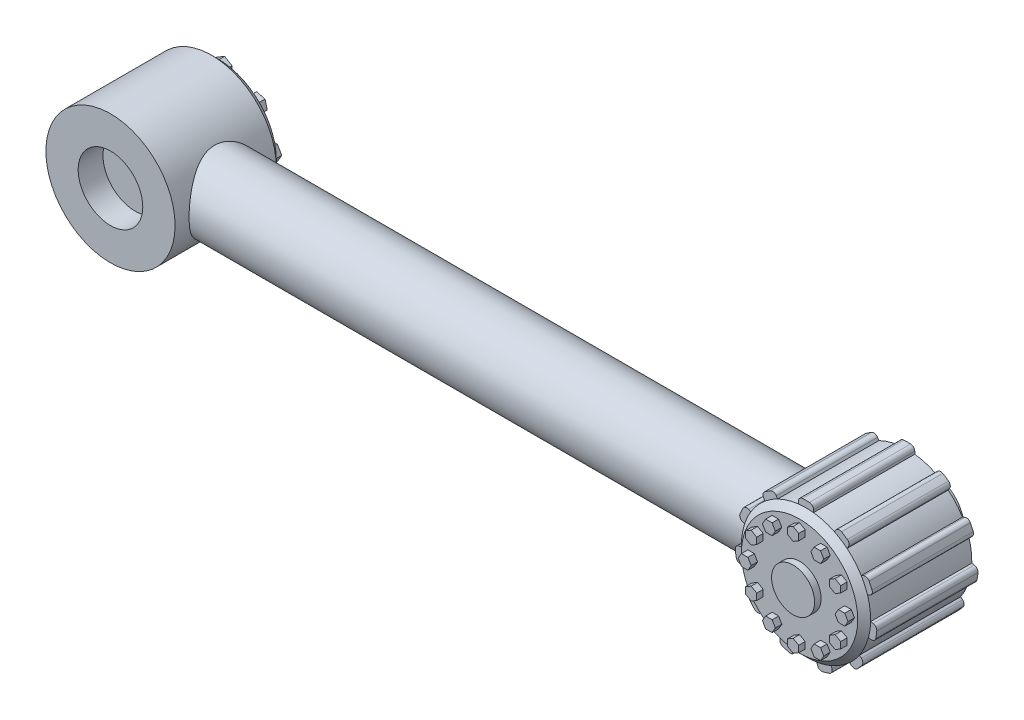
from build123d import *
from build123d.topology import SkipClean

# Parameters (mm, degrees)
BOSS_EXTRUDE2_DEPTH                  = 47
BOSS_EXTRUDE3_START                  = 3
SKETCH2_R                            = 30
BOSS_EXTRUDE3_DEPTH                  = 3
CHAMFER1_SIZE                        = 3
BOSS_EXTRUDE4_DEPTH                  = 3
BOSS_EXTRUDE4_DEPTH_BACK             = 47
SKETCH3_R                            = 30
CHAMFER2_SIZE                        = 3
SKETCH4_R                            = 15
CUT_EXTRUDE1_DEPTH                   = 11.5
SKETCH5_R                            = 15
BOSS_EXTRUDE5_DEPTH                  = 11.5
SKETCH6_R                            = 17.5
BOSS_EXTRUDE6_DEPTH                  = 163.5
BOSS_EXTRUDE6_DIRECTION_2_REACH      = 206.223
BOSS_EXTRUDE6_DIRECTION_2_END_RADIUS = 30
SKETCH7_R                            = 10
BOSS_EXTRUDE7_DEPTH                  = 3
SKETCH8_R                            = 10
BOSS_EXTRUDE8_DEPTH                  = 3


with BuildPart() as part:
    # Sketch1 → Boss-Extrude2 (new body)
    with BuildSketch(Plane.XY):
        with BuildLine():
            Line((156.5, 29.795133831), (156.5, 30.963688411))
            ThreePointArc((156.5, 30.963688411), (157.051975762, 32.343262913), (158.403225806, 32.961345728))
            ThreePointArc((158.403225806, 32.961345728), (160, 33), (161.596774194, 32.961345728))
            ThreePointArc((161.596774194, 32.961345728), (162.948024238, 32.343262913), (163.5, 30.963688411))
            Line((163.5, 30.963688411), (163.5, 29.795133831))
            ThreePointArc((163.5, 29.795133831), (168.451976705, 28.784789208), (173.164078146, 26.957504458))
            Line((173.164078146, 26.957504458), (173.795846449, 27.940555126))
            ThreePointArc((173.795846449, 27.940555126), (175.006052295, 28.802706422), (176.476956967, 28.592129846))
            ThreePointArc((176.476956967, 28.592129846), (177.841146976, 27.761366583), (179.16354083, 26.865567235))
            ThreePointArc((179.16354083, 26.865567235), (179.966123905, 25.615061955), (179.684621179, 24.156069404))
            Line((179.684621179, 24.156069404), (179.052852875, 23.173018735))
            ThreePointArc((179.052852875, 23.173018735), (182.672487231, 19.645822018), (185.648654493, 15.561057891))
            Line((185.648654493, 15.561057891), (186.711609127, 16.046493007))
            ThreePointArc((186.711609127, 16.046493007), (188.195813252, 16.117494153), (189.319370711, 15.14511476))
            ThreePointArc((189.319370711, 15.14511476), (190.017855847, 13.708695429), (190.646018656, 12.240160968))
            ThreePointArc((190.646018656, 12.240160968), (190.645120307, 10.754259814), (189.619514218, 9.67906904))
            Line((189.619514218, 9.67906904), (188.556559584, 9.193633924))
            ThreePointArc((188.556559584, 9.193633924), (189.694643256, 4.269445148), (189.989964263, -0.775914606))
            Line((189.989964263, -0.775914606), (191.146624643, -0.942217262))
            ThreePointArc((191.146624643, -0.942217262), (192.433602724, -1.684908629), (192.853091416, -3.110367252))
            ThreePointArc((192.853091416, -3.110367252), (192.664107582, -4.696389663), (192.398602093, -6.271409921))
            ThreePointArc((192.398602093, -6.271409921), (191.594507539, -7.520943833), (190.150420775, -7.870967355))
            Line((190.150420775, -7.870967355), (188.993760396, -7.704664699))
            ThreePointArc((188.993760396, -7.704664699), (187.288959861, -12.46245039), (184.809672279, -16.866539698))
            Line((184.809672279, -16.866539698), (185.692806906, -17.631780208))
            ThreePointArc((185.692806906, -17.631780208), (186.373952496, -18.952364826), (185.956187724, -20.378329638))
            ThreePointArc((185.956187724, -20.378329638), (184.939735954, -21.61040422), (183.864858283, -22.791852472))
            ThreePointArc((183.864858283, -22.791852472), (182.512861863, -23.408300952), (181.108781768, -22.922027229))
            Line((181.108781768, -22.922027229), (180.225647142, -22.156786719))
            ThreePointArc((180.225647142, -22.156786719), (176.219224524, -25.237605985), (171.752484643, -27.60215761))
            Line((171.752484643, -27.60215761), (172.081704513, -28.723377518))
            ThreePointArc((172.081704513, -28.723377518), (171.940758699, -30.202579102), (170.818377828, -31.17631635))
            ThreePointArc((170.818377828, -31.17631635), (169.297174376, -31.663268129), (167.75419059, -32.076042903))
            ThreePointArc((167.75419059, -32.076042903), (166.283541615, -31.863687915), (165.365253698, -30.695505416))
            Line((165.365253698, -30.695505416), (165.036033828, -29.574285508))
            ThreePointArc((165.036033828, -29.574285508), (160, -30), (154.963966172, -29.574285508))
            Line((154.963966172, -29.574285508), (154.634746302, -30.695505416))
            ThreePointArc((154.634746302, -30.695505416), (153.716458385, -31.863687915), (152.24580941, -32.076042903))
            ThreePointArc((152.24580941, -32.076042903), (150.702825624, -31.663268129), (149.181622172, -31.17631635))
            ThreePointArc((149.181622172, -31.17631635), (148.059241301, -30.202579102), (147.918295487, -28.723377518))
            Line((147.918295487, -28.723377518), (148.247515357, -27.60215761))
            ThreePointArc((148.247515357, -27.60215761), (143.780775476, -25.237605985), (139.774352858, -22.156786719))
            Line((139.774352858, -22.156786719), (138.891218232, -22.922027229))
            ThreePointArc((138.891218232, -22.922027229), (137.487138137, -23.408300952), (136.135141717, -22.791852472))
            ThreePointArc((136.135141717, -22.791852472), (135.060264046, -21.61040422), (134.043812276, -20.378329638))
            ThreePointArc((134.043812276, -20.378329638), (133.626047504, -18.952364826), (134.307193094, -17.631780208))
            Line((134.307193094, -17.631780208), (135.190327721, -16.866539698))
            ThreePointArc((135.190327721, -16.866539698), (132.711040139, -12.46245039), (131.006239604, -7.704664699))
            Line((131.006239604, -7.704664699), (129.849579225, -7.870967355))
            ThreePointArc((129.849579225, -7.870967355), (128.405492461, -7.520943833), (127.601397907, -6.271409921))
            ThreePointArc((127.601397907, -6.271409921), (127.335892418, -4.696389663), (127.146908584, -3.110367252))
            ThreePointArc((127.146908584, -3.110367252), (127.566397276, -1.684908629), (128.853375357, -0.942217262))
            Line((128.853375357, -0.942217262), (130.010035737, -0.775914606))
            ThreePointArc((130.010035737, -0.775914606), (130.305356744, 4.269445148), (131.443440416, 9.193633924))
            Line((131.443440416, 9.193633924), (130.380485782, 9.67906904))
            ThreePointArc((130.380485782, 9.67906904), (129.354879693, 10.754259814), (129.353981344, 12.240160968))
            ThreePointArc((129.353981344, 12.240160968), (129.982144153, 13.708695429), (130.680629289, 15.14511476))
            ThreePointArc((130.680629289, 15.14511476), (131.804186748, 16.117494153), (133.288390873, 16.046493007))
            Line((133.288390873, 16.046493007), (134.351345507, 15.561057891))
            ThreePointArc((134.351345507, 15.561057891), (137.327512769, 19.645822018), (140.947147125, 23.173018735))
            Line((140.947147125, 23.173018735), (140.315378821, 24.156069404))
            ThreePointArc((140.315378821, 24.156069404), (140.033876095, 25.615061955), (140.83645917, 26.865567235))
            ThreePointArc((140.83645917, 26.865567235), (142.158853024, 27.761366583), (143.523043033, 28.592129846))
            ThreePointArc((143.523043033, 28.592129846), (144.993947705, 28.802706422), (146.204153551, 27.940555126))
            Line((146.204153551, 27.940555126), (146.835921854, 26.957504457))
            ThreePointArc((146.835921854, 26.957504457), (151.548023295, 28.784789208), (156.5, 29.795133831))
        make_face()
    extrude(amount=-BOSS_EXTRUDE2_DEPTH)

    # Sketch2 → Boss-Extrude3 (add)
    with SkipClean():  # the faces are left unmerged after this step: merging them gives an invalid solid
        with BuildSketch(Plane.XY.offset(BOSS_EXTRUDE3_START)):
            with Locations((160, 0)):
                Circle(SKETCH2_R)
        extrude(amount=-BOSS_EXTRUDE3_DEPTH)

    # Chamfer1
    chamfer1_edges = [part.edges().sort_by_distance(p)[0] for p in [
        (130, 0, 3),
    ]]
    chamfer(chamfer1_edges, length=CHAMFER1_SIZE - 0.0001)  # a hair under: the kernel refuses the full size

    # Sketch5 → Boss-Extrude5 (add)
    with BuildSketch(Plane(origin=(0, 0, -47), x_dir=(-1, 0, 0), z_dir=(0, 0, -1))):
        with Locations(Location((-160, 0, 0), (0, 0, 180))):
            Circle(SKETCH5_R)
    extrude(amount=BOSS_EXTRUDE5_DEPTH)


with BuildPart() as body_2:
    # Sketch3 → Boss-Extrude4 (new, two sides: drawn at the far end of the back side and taken through both)
    with BuildSketch(Plane.XY.offset(-BOSS_EXTRUDE4_DEPTH_BACK)):
        with Locations((-160, 0)):
            Circle(SKETCH3_R)
    extrude(amount=BOSS_EXTRUDE4_DEPTH + BOSS_EXTRUDE4_DEPTH_BACK)

    # Chamfer2
    chamfer2_edges = [body_2.edges().sort_by_distance(p)[0] for p in [
        (-190, 0, -47),
    ]]
    chamfer(chamfer2_edges, length=CHAMFER2_SIZE)

    # Sketch4 → Cut-Extrude1 (cut)
    with BuildSketch(Plane.XY.offset(3)):
        with Locations((-160, 0)):
            Circle(SKETCH4_R)
    extrude(amount=-CUT_EXTRUDE1_DEPTH, mode=Mode.SUBTRACT)


    add(part.part)  # Boss-Extrude6 merges part
    # Sketch6 → Boss-Extrude6 (add)
    with BuildSketch(Plane(origin=(0, 0, 0), x_dir=(0, 0, -1), z_dir=(1, 0, 0))):
        with Locations(Location((21, 0, 0), (0, 0, 180))):
            Circle(SKETCH6_R)
    extrude(amount=BOSS_EXTRUDE6_DEPTH)

    # Boss-Extrude6 direction 2: up to this cylinder (the profile starts outside it)
    boss_extrude6_direction_2_end = Plane(origin=(-160, 0, -21), z_dir=(0, 0, -1)) * Cylinder(BOSS_EXTRUDE6_DIRECTION_2_END_RADIUS, 473.446, mode=Mode.PRIVATE)
    # Sketch6 → Boss-Extrude6 direction 2 (add, up to the surface)
    with BuildSketch(Plane(origin=(0, 0, 0), x_dir=(0, 0, -1), z_dir=(1, 0, 0)), mode=Mode.PRIVATE) as boss_extrude6_direction_2_sk1:
        with Locations(Location((21, 0, 0), (0, 0, 180))):
            Circle(SKETCH6_R)
    boss_extrude6_direction_2_tool1 = extrude(boss_extrude6_direction_2_sk1.sketch, amount=-BOSS_EXTRUDE6_DIRECTION_2_REACH, mode=Mode.PRIVATE) - boss_extrude6_direction_2_end
    add(boss_extrude6_direction_2_tool1.solids().sort_by_distance((0, 0, -21))[0])

    # Sketch7 → Boss-Extrude7 (add)
    with BuildSketch(Plane(origin=(0, 0, -47), x_dir=(-1, 0, 0), z_dir=(0, 0, -1))):
        with Locations(Location((160, 0, 0), (0, 0, 180))):
            Circle(SKETCH7_R)
        Polygon((178.768667247, 18.768667247), (174.864924496, 19.814671965), (172.007186463, 16.956933931), (173.053191181, 13.053191181), (176.956933931, 12.007186463), (179.814671965, 14.864924496), align=None)
        Polygon((160, 26.542903769), (156.5, 24.522177826), (156.5, 20.480725942), (160, 18.46), (163.5, 20.480725942), (163.5, 24.522177826), align=None)
        Polygon((186.542903769, 0), (184.522177826, 3.5), (180.480725942, 3.5), (178.46, 0), (180.480725942, -3.5), (184.522177826, -3.5), align=None)
        Polygon((178.768667247, -18.768667247), (179.814671965, -14.864924496), (176.956933931, -12.007186463), (173.053191181, -13.053191181), (172.007186463, -16.956933931), (174.864924496, -19.814671965), align=None)
        Polygon((160, -26.542903769), (163.5, -24.522177826), (163.5, -20.480725942), (160, -18.46), (156.5, -20.480725942), (156.5, -24.522177826), align=None)
        Polygon((141.231332753, -18.768667247), (145.135075504, -19.814671965), (147.992813537, -16.956933931), (146.946808819, -13.053191181), (143.043066069, -12.007186463), (140.185328035, -14.864924496), align=None)
        Polygon((133.457096231, 0), (135.477822174, -3.5), (139.519274058, -3.5), (141.54, 0), (139.519274058, 3.5), (135.477822174, 3.5), align=None)
        Polygon((141.231332753, 18.768667247), (140.185328035, 14.864924496), (143.043066069, 12.007186463), (146.946808819, 13.053191181), (147.992813537, 16.956933931), (145.135075504, 19.814671965), align=None)
    extrude(amount=BOSS_EXTRUDE7_DEPTH)

    # Sketch8 → Boss-Extrude8 (add)
    with BuildSketch(Plane.XY.offset(3)):
        with Locations((160, 0)):
            Circle(SKETCH8_R)
        Polygon((172.75, 22.083647797), (169.75, 22.083647797), (168.25, 19.485571585), (169.75, 16.887495374), (172.75, 16.887495374), (174.25, 19.485571585), align=None)
        Polygon((160, 25.5), (157.401923789, 24), (157.401923789, 21), (160, 19.5), (162.598076211, 21), (162.598076211, 24), align=None)
        Polygon((182.083647797, 12.75), (179.485571585, 14.25), (176.887495374, 12.75), (176.887495374, 9.75), (179.485571585, 8.25), (182.083647797, 9.75), align=None)
        Polygon((185.5, 0), (184, 2.598076211), (181, 2.598076211), (179.5, 0), (181, -2.598076211), (184, -2.598076211), align=None)
        Polygon((182.083647797, -12.75), (182.083647797, -9.75), (179.485571585, -8.25), (176.887495374, -9.75), (176.887495374, -12.75), (179.485571585, -14.25), align=None)
        Polygon((172.75, -22.083647797), (174.25, -19.485571585), (172.75, -16.887495374), (169.75, -16.887495374), (168.25, -19.485571585), (169.75, -22.083647797), align=None)
        Polygon((160, -25.5), (162.598076211, -24), (162.598076211, -21), (160, -19.5), (157.401923789, -21), (157.401923789, -24), align=None)
        Polygon((147.25, -22.083647797), (150.25, -22.083647797), (151.75, -19.485571585), (150.25, -16.887495374), (147.25, -16.887495374), (145.75, -19.485571585), align=None)
        Polygon((137.916352203, -12.75), (140.514428415, -14.25), (143.112504626, -12.75), (143.112504626, -9.75), (140.514428415, -8.25), (137.916352203, -9.75), align=None)
        Polygon((134.5, 0), (136, -2.598076211), (139, -2.598076211), (140.5, 0), (139, 2.598076211), (136, 2.598076211), align=None)
        Polygon((137.916352203, 12.75), (137.916352203, 9.75), (140.514428415, 8.25), (143.112504626, 9.75), (143.112504626, 12.75), (140.514428415, 14.25), align=None)
        Polygon((147.25, 22.083647797), (145.75, 19.485571585), (147.25, 16.887495374), (150.25, 16.887495374), (151.75, 19.485571585), (150.25, 22.083647797), align=None)
    extrude(amount=BOSS_EXTRUDE8_DEPTH)


solid = body_2.part
